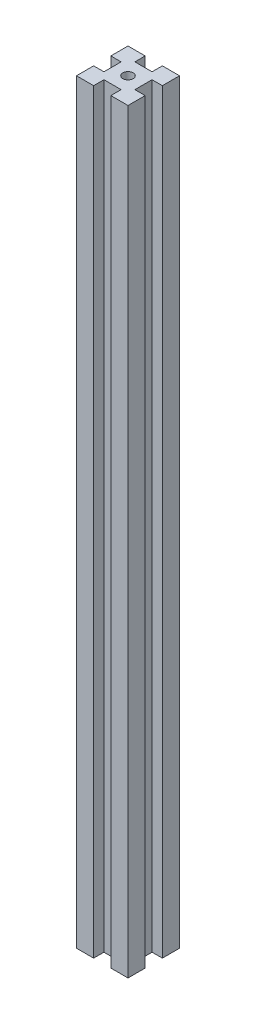
from build123d import *

# Parameters (mm, degrees)
SKETCH1_R           = 1.5
BOSS_EXTRUDE1_DEPTH = 220


with BuildPart() as part:
    # Sketch1 → Boss-Extrude1 (new body)
    with BuildSketch(Plane(origin=(0, 0, 0), x_dir=(1, 0, 0), z_dir=(0, 1, 0))):
        Polygon((-7.5, -7.5), (-2.5, -7.5), (-2.5, -4.5), (2.5, -4.5), (2.5, -7.5), (7.5, -7.5), (7.5, -2.5), (4.5, -2.5), (4.5, 2.5), (7.5, 2.5), (7.5, 7.5), (2.5, 7.5), (2.5, 4.5), (-2.5, 4.5), (-2.5, 7.5), (-7.5, 7.5), (-7.5, 2.5), (-4.5, 2.5), (-4.5, -2.5), (-7.5, -2.5), align=None)
        Circle(SKETCH1_R, mode=Mode.SUBTRACT)
    extrude(amount=BOSS_EXTRUDE1_DEPTH)


solid = part.part
